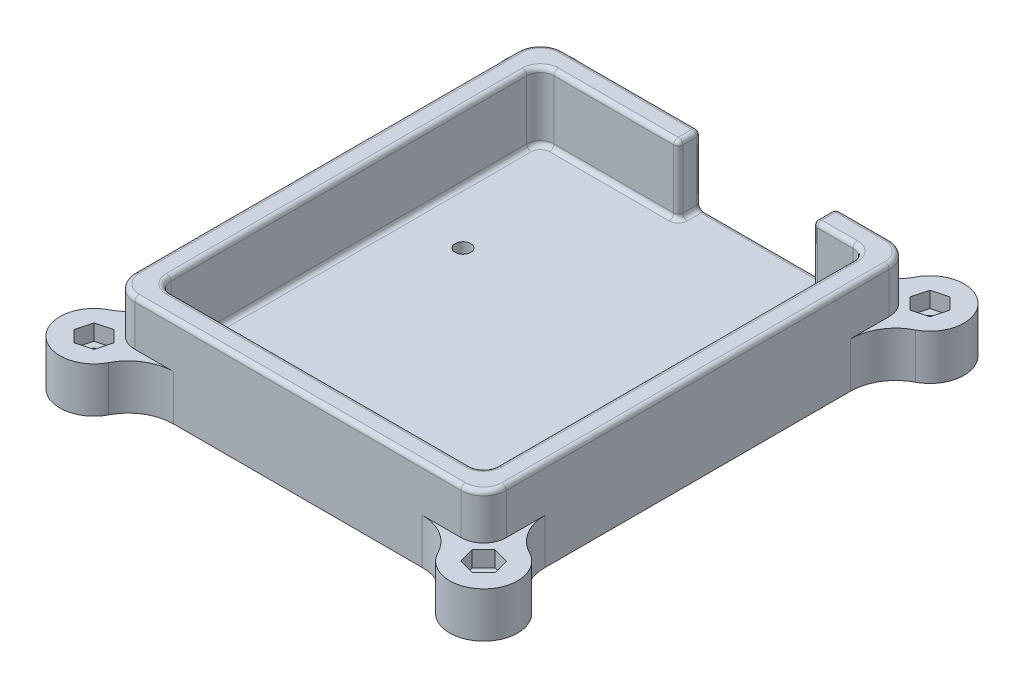
from build123d import *
from OCP.BRepFilletAPI import BRepFilletAPI_MakeFillet

# Parameters (mm, degrees)
SKETCH1_W            = 82
SKETCH1_H            = 94.5
BOSS_EXTRUDE1_DEPTH  = 10
CUT_EXTRUDE1_DEPTH   = 15
SKETCH3_R            = 7.5
BOSS_EXTRUDE2_DEPTH  = 10
FILLET1_R1           = 5
FILLET1_R2           = 3
CUT_EXTRUDE2_DEPTH   = 3.5
FILLET2_R            = 10
FILLET3_R            = 1
M3_CLEARANCE_HOLE1_D = 3.4


with BuildPart() as part:
    # Sketch1 → Boss-Extrude1 (new, symmetric)
    with BuildSketch(Plane(origin=(0, 0, 0), x_dir=(1, 0, 0), z_dir=(0, 1, 0))):
        Rectangle(SKETCH1_W, SKETCH1_H)
    extrude(amount=BOSS_EXTRUDE1_DEPTH, both=True)

    # Sketch2 → Cut-Extrude1 (cut)
    with BuildSketch(Plane(origin=(0, 10, 0), x_dir=(1, 0, 0), z_dir=(0, 1, 0))):
        Polygon((-36, 42.25), (-5.557124335, 42.25), (-5.557124335, 47.25), (24.161824318, 47.25), (24.161824318, 42.25), (36, 42.25), (36, -42.25), (-36, -42.25), align=None)
    extrude(amount=-CUT_EXTRUDE1_DEPTH, mode=Mode.SUBTRACT)

    # Sketch3 → Boss-Extrude2 (add)
    with BuildSketch(Plane(origin=(-16.862207818, -10, -50.542230899), x_dir=(1, 0, 0), z_dir=(0, 1, 0))):
        with Locations((-26.137792182, -1.292230899)):
            Circle(SKETCH3_R)
        with Locations((59.862207818, -1.292230899)):
            Circle(SKETCH3_R)
        with Locations((59.862207818, -99.792230899)):
            Circle(SKETCH3_R)
        with Locations((-26.137792182, -99.792230899)):
            Circle(SKETCH3_R)
    extrude(amount=BOSS_EXTRUDE2_DEPTH)

    # Fillet1: one fillet with a radius per group of edges: ONE call of the kernel's fillet builder (fillet() takes one radius for all edges)
    fillet1_edges_1 = [part.edges().sort_by_distance(p)[0] for p in [
        (-41, 5, -47.25),
        (41, 5, -47.25),
        (41, 5, 47.25),
        (-41, 5, 47.25),
    ]]
    fillet1_edges_2 = [part.edges().sort_by_distance(p)[0] for p in [
        (-36, 2.5, 42.25),
        (36, 2.5, 42.25),
        (-36, 2.5, -42.25),
        (36, 2.5, -42.25),
    ]]
    fillet1 = BRepFilletAPI_MakeFillet(part.part.solid().wrapped)
    for e in fillet1_edges_1:
        fillet1.Add(FILLET1_R1, e.wrapped)
    for e in fillet1_edges_2:
        fillet1.Add(FILLET1_R2, e.wrapped)
    add(Compound.cast(fillet1.Shape()), mode=Mode.REPLACE)

    # Sketch5 → Cut-Extrude2 (cut)
    with BuildSketch(Plane(origin=(0, 0, 0), x_dir=(1, 0, 0), z_dir=(0, 1, 0))):
        Polygon((-42.073538679, 45.792399278), (-39.542399278, 48.323538679), (-40.468860599, 51.781139401), (-43.926461321, 52.707600722), (-46.457600722, 50.176461321), (-45.531139401, 46.718860599), align=None)
        Polygon((46.457600722, 50.176461321), (43.926461321, 52.707600722), (40.468860599, 51.781139401), (39.542399278, 48.323538679), (42.073538679, 45.792399278), (45.531139401, 46.718860599), align=None)
        Polygon((43.926461321, -52.707600722), (46.457600722, -50.176461321), (45.531139401, -46.718860599), (42.073538679, -45.792399278), (39.542399278, -48.323538679), (40.468860599, -51.781139401), align=None)
        Polygon((-45.531139401, -46.718860599), (-46.457600722, -50.176461321), (-43.926461321, -52.707600722), (-40.468860599, -51.781139401), (-39.542399278, -48.323538679), (-42.073538679, -45.792399278), align=None)
    extrude(amount=-CUT_EXTRUDE2_DEPTH, mode=Mode.SUBTRACT)

    # Fillet2
    fillet2_edges = [part.edges().sort_by_distance(p)[0] for p in [
        (-41, -5, 42.021583853),
        (-35.771583853, -5, 47.25),
        (35.771583853, -5, 47.25),
        (41, -5, 42.021583853),
        (41, -5, -42.021583853),
        (35.771583853, -5, -47.25),
        (-41, -5, -42.021583853),
        (-35.771583853, -5, -47.25),
    ]]
    fillet(fillet2_edges, radius=FILLET2_R)

    # Fillet3
    fillet3_edges = [part.edges().sort_by_distance(p)[0] for p in [
        (0, -5, 42.25),
        (35.121320344, -5, 41.371320344),
        (-35.121320344, -5, 41.371320344),
        (36, -5, 0),
        (-36, -5, 0),
        (35.121320344, -5, -41.371320344),
        (-35.121320344, -5, -41.371320344),
        (28.580912159, -5, -42.25),
        (9.302349992, -5, -47.25),
        (-19.278562167, -5, -42.25),
        (24.161824318, 2.5, -42.25),
        (24.161824318, -5, -44.75),
        (24.161824318, 2.5, -47.25),
        (-5.557124335, 2.5, -47.25),
        (-5.557124335, -5, -44.75),
        (-5.557124335, 2.5, -42.25),
        (-39.535533906, 10, -45.785533906),
        (-20.778562167, 10, -47.25),
        (-5.557124335, 10, -44.75),
        (-19.278562167, 10, -42.25),
        (-35.121320344, 10, -41.371320344),
        (-36, 10, 0),
        (-35.121320344, 10, 41.371320344),
        (0, 10, 42.25),
        (35.121320344, 10, 41.371320344),
        (36, 10, 0),
        (35.121320344, 10, -41.371320344),
        (28.580912159, 10, -42.25),
        (24.161824318, 10, -44.75),
        (30.080912159, 10, -47.25),
        (39.535533906, 10, -45.785533906),
        (41, 10, 0),
        (39.535533906, 10, 45.785533906),
        (0, 10, 47.25),
        (-39.535533906, 10, 45.785533906),
        (-41, 10, 0),
    ]]
    fillet(fillet3_edges, radius=FILLET3_R)

    # M3 Clearance Hole1 (through all)
    with Locations(Plane(origin=(0, -3.5, 0), x_dir=(1, 0, 0), z_dir=(0, 1, 0))):
        with Locations((-43, 49.25), (43, 49.25), (43, -49.25), (-43, -49.25), (-24.13, 13.32), (24.13, 12.05), (8.89, -38.75)):
            Hole(M3_CLEARANCE_HOLE1_D / 2)


solid = part.part
